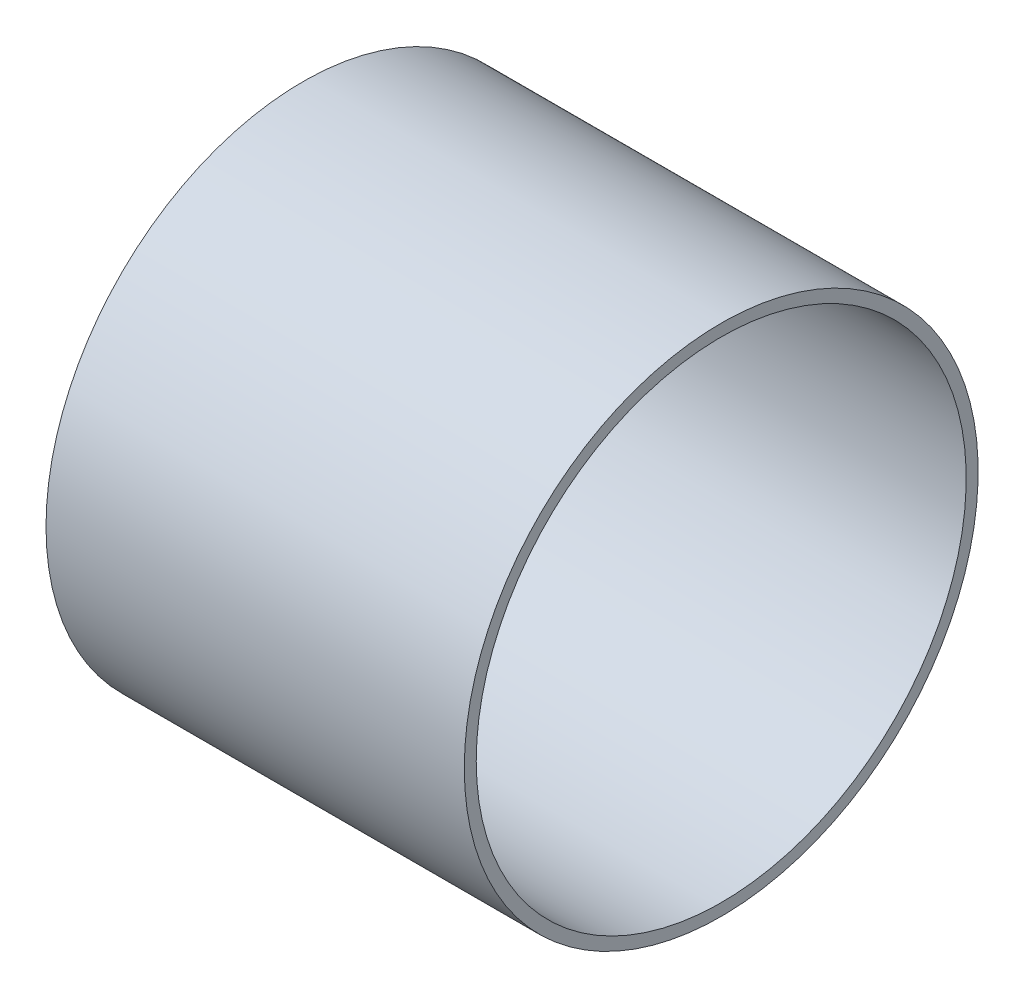
from build123d import *

# Parameters (mm, degrees)
ESQUISSE1_W = 35
ESQUISSE1_H = 1


with BuildPart() as part:
    # Esquisse1 → Révolution1 (revolve)
    with BuildSketch(Plane.XY):
        with Locations((0, 21)):
            Rectangle(ESQUISSE1_W, ESQUISSE1_H)
    revolve(axis=Axis((-29.925099206, 0, 0), (1, 0, 0)))


solid = part.part
